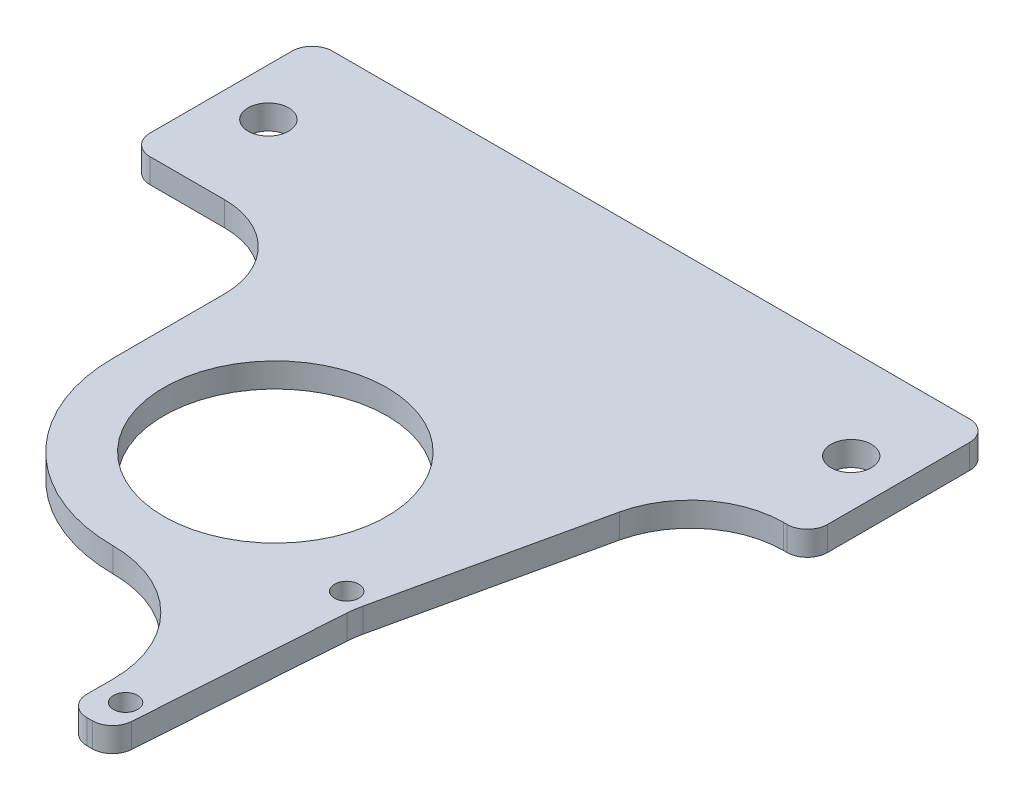
from build123d import *

# Parameters (mm, degrees)
SKETCH1_R           = 27.5
SKETCH1_R_2         = 3
SKETCH1_R_3         = 5
BOSS_EXTRUDE1_DEPTH = 6
FILLET1_R           = 5


with BuildPart() as part:
    # Sketch1 → Boss-Extrude1 (new body)
    with BuildSketch(Plane(origin=(0, 0, 0), x_dir=(1, 0, 0), z_dir=(0, 1, 0))):
        with BuildLine():
            Line((-83.5, 92.60002775), (83.5, 92.60002775))
            Line((83.5, 92.60002775), (83.5, 47.6))
            Line((83.5, 47.6), (77.649944321, 47.6))
            ThreePointArc((77.649944321, 47.6), (63.262449751, 42.544358445), (55.2, 29.6))
            Line((55.2, 29.6), (43.692619616, -22.06800978))
            ThreePointArc((43.692619616, -22.06800978), (43.380057159, -23.771301539), (43.196535229, -25.49328232))
            Line((43.196535229, -25.49328232), (39.782384757, -75.242332057))
            ThreePointArc((39.782384757, -75.242332057), (38.206473118, -78.554562921), (34.794117647, -79.9))
            Line((34.794117647, -79.9), (33.462740879, -79.9))
            ThreePointArc((33.462740879, -79.9), (29.927206973, -78.435533906), (28.462740879, -74.9))
            Line((28.462740879, -74.9), (28.462740879, -68.462740879))
            ThreePointArc((28.462740879, -68.462740879), (20.126197087, -48.336543792), (0, -40))
            ThreePointArc((0, -40), (-28.284271247, -28.284271247), (-40, 0))
            Line((-40, 0), (-40, 27.475324152))
            ThreePointArc((-40, 27.475324152), (-45.894381087, 41.705618913), (-60.124675848, 47.6))
            Line((-60.124675848, 47.6), (-83.5, 47.6))
            Line((-83.5, 47.6), (-83.5, 92.60002775))
        make_face()
        Circle(SKETCH1_R, mode=Mode.SUBTRACT)
        with Locations((38.5, -20.9)):
            Circle(SKETCH1_R_2, mode=Mode.SUBTRACT)
        with Locations((35, -71.9)):
            Circle(SKETCH1_R_2, mode=Mode.SUBTRACT)
        with Locations((-71.812337924, 70.100013875)):
            Circle(SKETCH1_R_3, mode=Mode.SUBTRACT)
        with Locations((71.812337924, 70.100013875)):
            Circle(SKETCH1_R_3, mode=Mode.SUBTRACT)
    extrude(amount=BOSS_EXTRUDE1_DEPTH)

    # Fillet1
    fillet1_edges = [part.edges().sort_by_distance(p)[0] for p in [
        (83.5, 3, -47.6),
        (83.5, 3, -92.60002775),
        (-83.5, 3, -92.60002775),
        (-83.5, 3, -47.6),
    ]]
    fillet(fillet1_edges, radius=FILLET1_R)


solid = part.part
